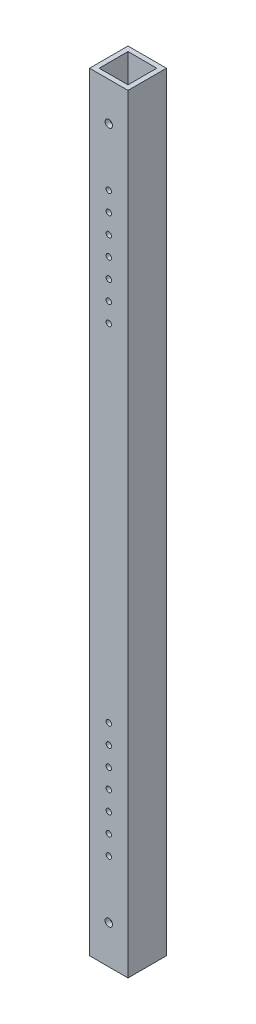
from build123d import *

# Parameters (mm, degrees)
SKETCH1_W                        = 25.4
SKETCH1_H                        = 25.4
SKETCH1_W_2                      = 19.05
SKETCH1_H_2                      = 19.05
BOSS_EXTRUDE1_DEPTH              = 254
F_10_0_1935_DIAMETER_HOLE1_D     = 4.9149
F_10_0_1935_DIAMETER_HOLE1_DEPTH = 50.8
F_10_0_1935_DIAMETER_HOLE1_TIP   = 1.476584928
SKETCH5_R                        = 1.778
CUT_EXTRUDE1_DEPTH               = 256.582569828


with BuildPart() as part:
    # Sketch1 → Boss-Extrude1 (new, symmetric)
    with BuildSketch(Plane(origin=(0, 0, 0), x_dir=(1, 0, 0), z_dir=(0, 1, 0))):
        Rectangle(SKETCH1_W, SKETCH1_H)
        Rectangle(SKETCH1_W_2, SKETCH1_H_2, mode=Mode.SUBTRACT)
    extrude(amount=BOSS_EXTRUDE1_DEPTH, both=True)

    # #10 (0.1935) Diameter Hole1
    with Locations(Plane(origin=(0, 0, -12.7), x_dir=(-1, 0, 0), z_dir=(0, 0, -1))):
        with Locations((0, 228.6), (0, -228.6)):
            Hole(F_10_0_1935_DIAMETER_HOLE1_D / 2, depth=F_10_0_1935_DIAMETER_HOLE1_DEPTH)
            with Locations((0, 0, -(F_10_0_1935_DIAMETER_HOLE1_DEPTH + F_10_0_1935_DIAMETER_HOLE1_TIP / 2))):  # 118° drill point
                Cone(0, F_10_0_1935_DIAMETER_HOLE1_D / 2, F_10_0_1935_DIAMETER_HOLE1_TIP, mode=Mode.SUBTRACT)

    # Sketch5 → Cut-Extrude1 (cut, through all)
    with BuildSketch(Plane.XY.offset(12.7)):
        with Locations((0, 190.5)):
            Circle(SKETCH5_R)
        with Locations((0, 139.7)):
            Circle(SKETCH5_R)
        with Locations((0, 177.8)):
            Circle(SKETCH5_R)
        with Locations((0, 165.1)):
            Circle(SKETCH5_R)
        with Locations((0, 152.4)):
            Circle(SKETCH5_R)
        with Locations((0, 127)):
            Circle(SKETCH5_R)
        with Locations((0, 114.3)):
            Circle(SKETCH5_R)
    cut_extrude1 = extrude(amount=-CUT_EXTRUDE1_DEPTH, mode=Mode.SUBTRACT)

    # Mirror1: Cut-Extrude1 across plane
    add(cut_extrude1.mirror(Plane.ZX), mode=Mode.SUBTRACT)


solid = part.part
